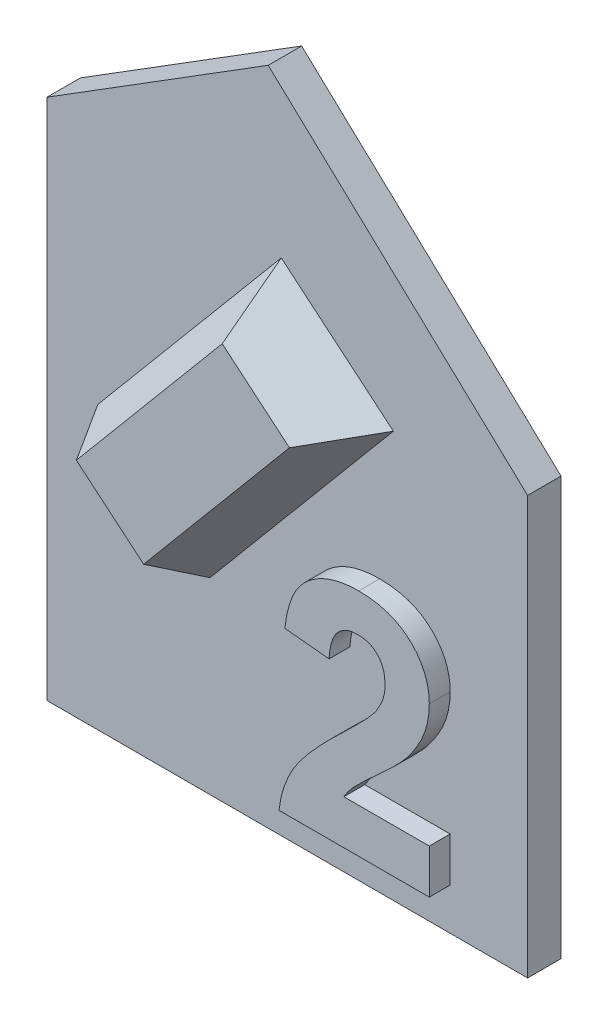
from build123d import *

# Parameters (mm, degrees)
P_IDAT_VYSUNUT_M5_DEPTH = 1.6
P_IDAT_VYSUNUT_M6_DEPTH = 1
P_IDAT_VYSUNUT_M7_DEPTH = 3
ZKOSEN_1_SIZE           = 3
ZKOSEN_1_SIZE_2         = 1.398922974


with BuildPart() as part:
    # Skica1 → Přidat vysunutím5 (new body)
    with BuildSketch(Plane.XY):
        Polygon((0, 0), (0, 20), (-12.412784718, 31.615626352), (-23, 25), (-23, 0), align=None)
    extrude(amount=P_IDAT_VYSUNUT_M5_DEPTH)

    # Skica2 → Přidat vysunutím6 (add)
    with BuildSketch(Plane.XY.offset(1.6)):
        with BuildLine():
            Line((-3.705128205, 4.115384615), (-3.705128205, 2))
            Line((-3.705128205, 2), (-10.897435897, 2))
            add(Edge.make_bspline(
                [(-10.897435897, 2), (-10.87308441, 2.180790308), (-10.824395089, 2.542269551), (-10.673865117, 3.070299742), (-10.472959166, 3.585566992), (-10.254913916, 4.004869463), (-10.038043764, 4.342393523), (-9.841277463, 4.618963346), (-9.60654249, 4.913221767), (-9.337245105, 5.227544267), (-9.034873554, 5.562913411), (-8.697171951, 5.918082368), (-8.322529407, 6.291350846), (-8.058961705, 6.54481851), (-7.922676282, 6.67588141)],
                knots=[0, 0, 0, 0, 1.156289446, 2.311930546, 3.473459201, 4.661751613, 5.303057008, 6.018253237, 6.81459331, 7.690699809, 8.644447906, 9.679642995, 10.800191253, 12, 12, 12, 12], degree=3))
            add(Edge.make_bspline(
                [(-7.922676282, 6.67588141), (-7.813918956, 6.780862005), (-7.606877039, 6.980714138), (-7.312048947, 7.266894293), (-7.052864674, 7.529975199), (-6.823905036, 7.763139303), (-6.630459323, 7.972323552), (-6.469982936, 8.154242742), (-6.34044346, 8.309637702), (-6.270284768, 8.408220362), (-6.239182692, 8.451923077)],
                knots=[0, 0, 0, 0, 1.480720495, 2.818855715, 4.024636094, 5.098235712, 6.019786162, 6.815086302, 7.474715479, 8, 8, 8, 8], degree=3))
            add(Edge.make_bspline(
                [(-6.239182692, 8.451923077), (-6.175493233, 8.557718073), (-6.052643645, 8.761784362), (-5.91792888, 9.082682292), (-5.837068057, 9.403513936), (-5.825971765, 9.617891805), (-5.820512821, 9.723357372)],
                knots=[0, 0, 0, 0, 1.0911822, 2.104764037, 3.067617678, 4, 4, 4, 4], degree=3))
            add(Edge.make_bspline(
                [(-5.820512821, 9.723357372), (-5.824474653, 9.833108474), (-5.831970132, 10.040748999), (-5.894821019, 10.333768175), (-6.006276867, 10.585659667), (-6.15973106, 10.797196661), (-6.353774193, 10.962935085), (-6.580616259, 11.085399693), (-6.843577862, 11.153106661), (-7.028402789, 11.16201224), (-7.125, 11.166666667)],
                knots=[0, 0, 0, 0, 1.193122327, 2.257294386, 3.237245624, 4.168877528, 5.075331632, 5.990371598, 6.949684428, 8, 8, 8, 8], degree=3))
            add(Edge.make_bspline(
                [(-7.125, 11.166666667), (-7.220944609, 11.16231978), (-7.406288878, 11.153922533), (-7.669703299, 11.080565334), (-7.900142302, 10.953576306), (-8.06436539, 10.808860058), (-8.175305876, 10.668134018), (-8.250896853, 10.545500545), (-8.316050374, 10.406151312), (-8.37378183, 10.251655158), (-8.419383153, 10.080242168), (-8.456107626, 9.893217825), (-8.485702239, 9.689575671), (-8.495113848, 9.547907653), (-8.5, 9.474358974)],
                knots=[0, 0, 0, 0, 1.402788338, 2.709884207, 3.961032948, 5.225417836, 5.883680772, 6.578928686, 7.329201998, 8.132101139, 8.990263233, 9.922304639, 10.921339128, 12, 12, 12, 12], degree=3))
            Line((-8.5, 9.474358974), (-10.615384615, 9.681490385))
            add(Edge.make_bspline(
                [(-10.615384615, 9.681490385), (-10.598377251, 9.824305509), (-10.565402688, 10.101201217), (-10.483114114, 10.498918926), (-10.378898684, 10.865831465), (-10.247788098, 11.201257911), (-10.095201314, 11.507331251), (-9.913355139, 11.779458664), (-9.708603468, 12.020654551), (-9.480769352, 12.230790543), (-9.231301205, 12.410535137), (-8.969529148, 12.57098477), (-8.690337423, 12.702604473), (-8.396799939, 12.811078884), (-8.089049352, 12.897770766), (-7.765662274, 12.955090263), (-7.42863453, 12.995409017), (-7.198577984, 12.998446608), (-7.080929487, 13)],
                knots=[0, 0, 0, 0, 1.270971563, 2.464210789, 3.586263665, 4.638946707, 5.643716971, 6.603612468, 7.52484387, 8.434700188, 9.336036235, 10.239171475, 11.145359471, 12.059630629, 13.003312604, 13.96741569, 14.960557767, 16, 16, 16, 16], degree=3))
            add(Edge.make_bspline(
                [(-7.080929487, 13), (-6.953030371, 12.997541845), (-6.703930784, 12.992754281), (-6.34028961, 12.953218534), (-5.998674853, 12.884282231), (-5.676099879, 12.79296634), (-5.375877361, 12.67105295), (-5.095505554, 12.52366473), (-4.83939702, 12.345207999), (-4.603734114, 12.145414763), (-4.393070332, 11.925706984), (-4.20854792, 11.691351493), (-4.053955652, 11.442511564), (-3.924228998, 11.182220281), (-3.827907833, 10.90628918), (-3.757724044, 10.618533633), (-3.711189366, 10.317611197), (-3.707170936, 10.112088), (-3.705128205, 10.007612179)],
                knots=[0, 0, 0, 0, 1.210756838, 2.35810096, 3.457354827, 4.507168606, 5.527358126, 6.519769748, 7.499700793, 8.476517721, 9.440526811, 10.376769937, 11.295256217, 12.209626307, 13.124630862, 14.055668209, 15.011616881, 16, 16, 16, 16], degree=3))
            add(Edge.make_bspline(
                [(-3.705128205, 10.007612179), (-3.707819477, 9.887707131), (-3.713158546, 9.649833916), (-3.764276175, 9.298186238), (-3.84237396, 8.954647512), (-3.957796338, 8.618378159), (-4.104103161, 8.28131186), (-4.292696164, 7.942692037), (-4.511666905, 7.592306518), (-4.683112364, 7.36576699), (-4.771634615, 7.248798077)],
                knots=[0, 0, 0, 0, 0.953409949, 1.89141903, 2.821310783, 3.752688675, 4.715703262, 5.740811754, 6.833515735, 8, 8, 8, 8], degree=3))
            add(Edge.make_bspline(
                [(-4.771634615, 7.248798077), (-4.80509214, 7.206658226), (-4.876750403, 7.116404431), (-4.998659939, 6.978014195), (-5.139942605, 6.826848432), (-5.298602846, 6.660077667), (-5.479881522, 6.483607708), (-5.677256214, 6.290058721), (-5.899411985, 6.089331377), (-6.12951153, 5.876418507), (-6.360611244, 5.669193404), (-6.5730252, 5.472375498), (-6.765967752, 5.298233923), (-6.930453202, 5.137155265), (-7.076156545, 5.000133027), (-7.197826149, 4.880140867), (-7.29773874, 4.780083699), (-7.43541186, 4.624119958), (-7.610585282, 4.413178934), (-7.733826947, 4.21161882), (-7.792668269, 4.115384615)],
                knots=[0, 0, 0, 0, 0.665555651, 1.425465941, 2.280616993, 3.225313414, 4.272635571, 5.410053715, 6.644756443, 7.976022804, 9.288331007, 10.484517221, 11.558462543, 12.503158964, 13.33222979, 14.032602617, 14.617328242, 15.080653724, 16.606167857, 18, 18, 18, 18], degree=3))
            Line((-7.792668269, 4.115384615), (-3.705128205, 4.115384615))
        make_face()
    extrude(amount=P_IDAT_VYSUNUT_M6_DEPTH)

    # Skica3 → Přidat vysunutím7 (add)
    with BuildSketch(Plane.XY.offset(1.6)):
        Polygon((-15.200672089, 8.988396037), (-6.42438967, 19.447562139), (-11.786700772, 23.947075407), (-20.562983191, 13.487909304), align=None)
    extrude(amount=P_IDAT_VYSUNUT_M7_DEPTH)

    # Zkosení1
    # the kernel refuses this chamfer: 3, 1.398922974 mm, written as the material it takes off along each edge
    with BuildSketch(Plane(origin=(-26.517390277, 18.484250095, 4.6), x_dir=(-0.010484614203041273, -0.012495076643438774, -0.9998669641130704), z_dir=(0.7660444431189795, -0.6427876096865376, 0))) as zkosen_1_piece_1:
        Polygon((ZKOSEN_1_SIZE * 0.999866964113, ZKOSEN_1_SIZE * 0.0163111641311), (-ZKOSEN_1_SIZE_2 * 0.0163111641365, ZKOSEN_1_SIZE_2 * 0.999866964445), (0, 0), align=None)
    extrude(amount=14.772926414, mode=Mode.SUBTRACT)
    with BuildSketch(Plane(origin=(-6.790359982, 29.901482493, 4.6), x_dir=(-0.01249507664343894, 0.010484614203041415, -0.9998669641130704), z_dir=(-0.6427876096865377, -0.7660444431189796, 0)), Plane(origin=(-20.197012879, 3.03398895, 4.6), x_dir=(0.012495076643438493, -0.010484614203041037, -0.9998669641130704), z_dir=(0.6427876096865377, 0.7660444431189796, 0))) as zkosen_1_piece_2:
        Polygon((ZKOSEN_1_SIZE * 0.999866964113, ZKOSEN_1_SIZE * 0.0163111641311), (-ZKOSEN_1_SIZE_2 * 0.0163111641365, ZKOSEN_1_SIZE_2 * 0.999866964445), (0, 0), align=None)
    extrude(amount=29.199324499, mode=Mode.SUBTRACT)
    with BuildSketch(Plane(origin=(-0.469982584, 14.451221349, 4.6), x_dir=(0.010484614203041209, 0.01249507664343868, -0.9998669641130704), z_dir=(-0.766044443118979, 0.6427876096865381, 0))) as zkosen_1_piece_3:
        Polygon((ZKOSEN_1_SIZE * 0.999866964113, ZKOSEN_1_SIZE * 0.0163111641311), (-ZKOSEN_1_SIZE_2 * 0.0163111641365, ZKOSEN_1_SIZE_2 * 0.999866964445), (0, 0), align=None)
    extrude(amount=22.545852829, mode=Mode.SUBTRACT)


solid = part.part
